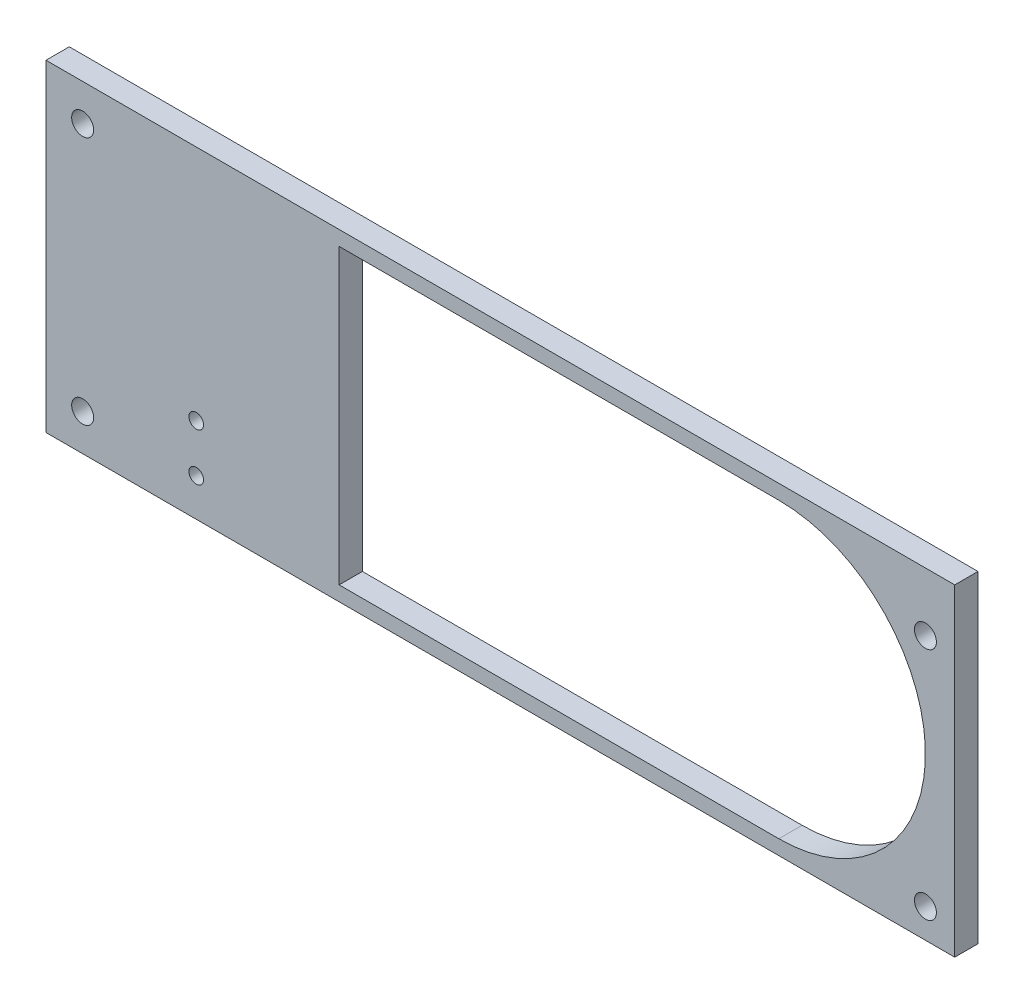
from build123d import *

# Parameters (mm, degrees)
SKETCH1_R           = 1.5
SKETCH1_R_2         = 1
BOSS_EXTRUDE1_DEPTH = 3.175


with BuildPart() as part:
    # Sketch1 → Boss-Extrude1 (new body)
    with BuildSketch(Plane.XY):
        Polygon((0, 0), (100, 0), (124, 0), (124, 44), (100, 44), (0, 44), align=None)
        with Locations((120, 36)):
            Circle(SKETCH1_R, mode=Mode.SUBTRACT)
        with Locations((120, 4)):
            Circle(SKETCH1_R, mode=Mode.SUBTRACT)
        with Locations((5, 39)):
            Circle(SKETCH1_R, mode=Mode.SUBTRACT)
        with Locations((5, 5)):
            Circle(SKETCH1_R, mode=Mode.SUBTRACT)
        with Locations((20.5, 11.65)):
            Circle(SKETCH1_R_2, mode=Mode.SUBTRACT)
        with Locations((20.5, 5.15)):
            Circle(SKETCH1_R_2, mode=Mode.SUBTRACT)
        with BuildLine():
            Line((40, 2), (40, 42))
            Line((40, 42), (100, 42))
            ThreePointArc((100, 42), (120, 22), (100, 2))
            Line((100, 2), (40, 2))
        make_face(mode=Mode.SUBTRACT)
    extrude(amount=BOSS_EXTRUDE1_DEPTH)


solid = part.part
